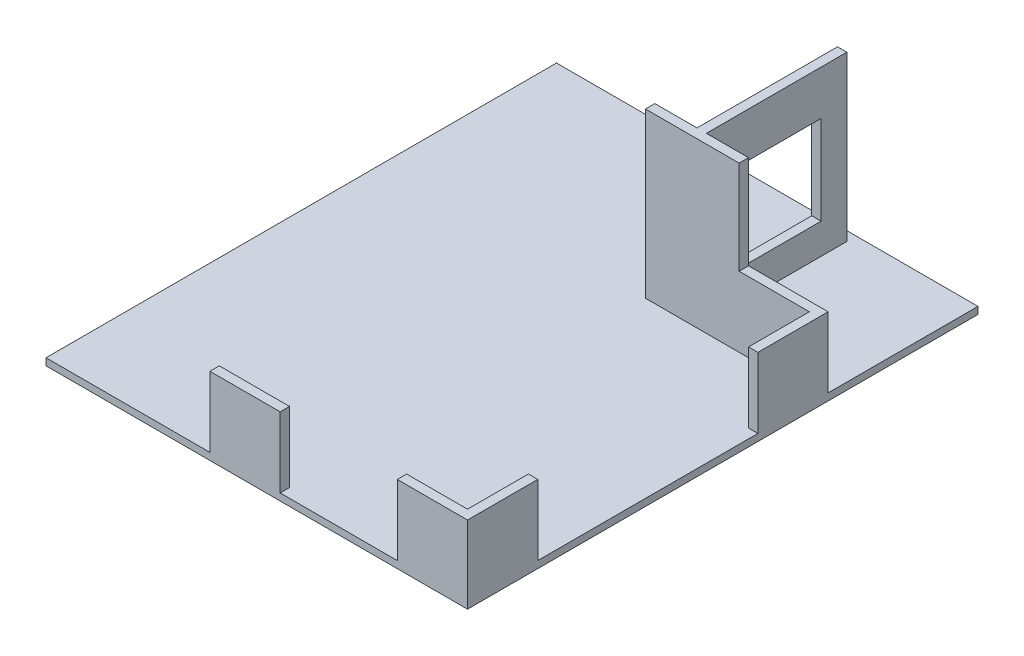
from build123d import *

# Parameters (mm, degrees)
SKETCH1_W           = 180
SKETCH1_H           = 218
BOSS_EXTRUDE1_DEPTH = 3
SKETCH2_W           = 30
SKETCH2_H           = 4
BOSS_EXTRUDE2_DEPTH = 30
BOSS_EXTRUDE3_DEPTH = 70
SKETCH5_W           = 38
SKETCH5_H           = 38
CUT_EXTRUDE1_DEPTH  = 10


with BuildPart() as part:
    # Sketch1 → Boss-Extrude1 (new body)
    with BuildSketch(Plane(origin=(0, 0, 0), x_dir=(1, 0, 0), z_dir=(0, 1, 0))):
        with Locations((90, 109)):
            Rectangle(SKETCH1_W, SKETCH1_H)
    extrude(amount=BOSS_EXTRUDE1_DEPTH)

    # Sketch2 → Boss-Extrude2 (add)
    with BuildSketch(Plane(origin=(0, 3, 0), x_dir=(1, 0, 0), z_dir=(0, 1, 0))):
        with Locations((85, 2)):
            Rectangle(SKETCH2_W, SKETCH2_H)
        Polygon((150, 0), (180, 0), (180, 30), (176, 30), (176, 4), (150, 4), align=None)
        Polygon((180, 124), (180, 154), (146, 154), (146, 150), (176, 150), (176, 124), align=None)
    extrude(amount=BOSS_EXTRUDE2_DEPTH)

    # Sketch4 → Boss-Extrude3 (add)
    with BuildSketch(Plane(origin=(0, 3, 0), x_dir=(1, 0, 0), z_dir=(0, 1, 0))):
        Polygon((124, 154), (124, 214), (128, 214), (128, 154), (146, 154), (146, 150), (106, 150), (106, 154), align=None)
    extrude(amount=BOSS_EXTRUDE3_DEPTH)

    # Sketch5 → Cut-Extrude1 (cut)
    with BuildSketch(Plane(origin=(128, 0, 0), x_dir=(0, 0, -1), z_dir=(1, 0, 0))):
        with Locations((184, 35)):
            Rectangle(SKETCH5_W, SKETCH5_H)
    extrude(amount=-CUT_EXTRUDE1_DEPTH, mode=Mode.SUBTRACT)


solid = part.part
